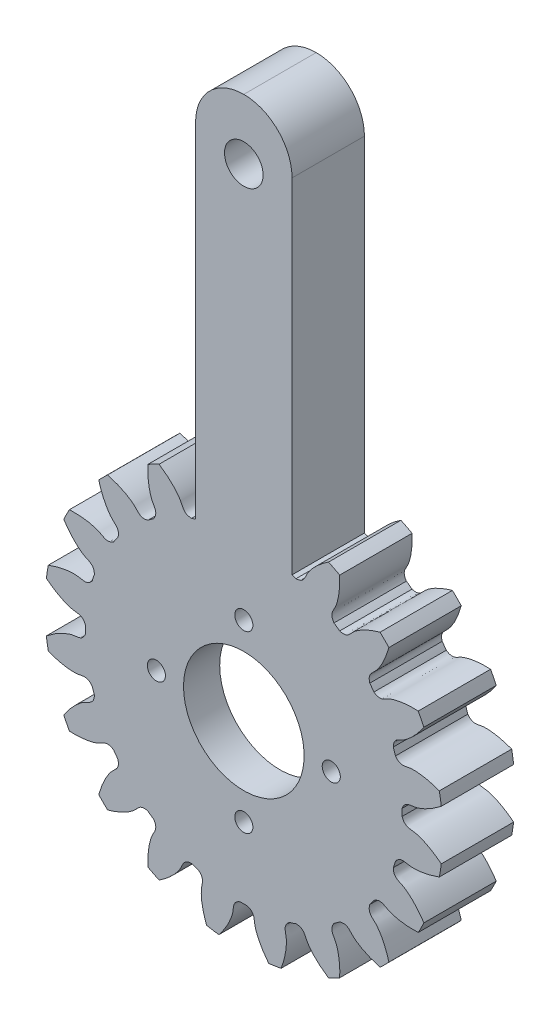
from build123d import *

# Parameters (mm, degrees)
SKETCH_1_R               = 16.5
EXTRUDE_1_DEPTH          = 6
CUT_EXTRUDE_1_DEPTH      = 25.093567606
PATTERN_CIRCULAR_1_COUNT = 20
SKETCH_5_R               = 10.75
CUT_EXTRUDE_2_DEPTH      = 3
SKETCH_6_R               = 5
CUT_EXTRUDE_3_DEPTH      = 3
SKETCH_7_R               = 0.75
CUT_EXTRUDE_4_DEPTH      = 3
SKETCH_8_W               = 8
SKETCH_8_H               = 38.434899951
EXTRUDE_2_DEPTH          = 6
SKETCH_9_R               = 1.6
SKETCH_9_W               = 8
SKETCH_9_H               = 5
CUT_EXTRUDE_5_DEPTH      = 10
FILLET_1_R               = 4


with BuildPart() as part:
    # 草图1 → 凸台-拉伸1 (new body)
    with BuildSketch(Plane.XY):
        Circle(SKETCH_1_R)
    extrude(amount=EXTRUDE_1_DEPTH)

    # 草图2 → 切除-拉伸1 (cut, through all)
    with BuildSketch(Plane.XY):
        with BuildLine():
            ThreePointArc((0.289974901, 13.121796354), (0, 13.125), (-0.289974901, 13.121796354))
            add(Edge.make_bspline(
                [(-0.289974901, 13.121796354), (-0.916784107, 13.340213268), (-0.835626149, 13.780670548), (-0.919345585, 14.205014104), (-0.928338279, 14.246334921), (-0.939466335, 14.292951923), (-0.952938145, 14.344795254), (-0.96896871, 14.401787245), (-0.987768083, 14.463844242), (-1.009544807, 14.5308761), (-1.034504625, 14.602786421), (-1.06285065, 14.679472568), (-1.094783098, 14.760825751), (-1.130499153, 14.846731096), (-1.170192797, 14.937067727), (-1.214054647, 15.031708847), (-1.2622718, 15.130521826), (-1.315027675, 15.233368292), (-1.372501858, 15.340104225), (-1.434869948, 15.450580056), (-1.502303414, 15.564640771), (-1.574969439, 15.682126017), (-1.653030782, 15.802870208), (-1.736645634, 15.926702646), (-1.825967477, 16.05344763), (-1.921144951, 16.182924586), (-2.022321721, 16.314948181), (-2.129636342, 16.449328459), (-2.24322214, 16.585870967), (-2.363207078, 16.724376892), (-2.489713645, 16.864643194), (-2.622858733, 17.006462752), (-2.762753527, 17.149624504), (-2.909503389, 17.29391359), (-3.06320776, 17.439111509), (-3.223960048, 17.584996263), (-3.391847534, 17.731342516), (-3.566951278, 17.877921749), (-3.749346018, 18.024502419), (-3.939100102, 18.170850122), (-4.136275349, 18.31672776), (-4.412210386, 18.512459802), (-4.625898619, 18.654498902), (-4.771736973, 18.747377789)],
                knots=[0, 0, 0, 0, 0.165916003, 0.170905922, 0.176663519, 0.183188797, 0.190481754, 0.198542391, 0.207370708, 0.216966704, 0.22733038, 0.238461736, 0.250360771, 0.263027487, 0.276461881, 0.290663956, 0.30563371, 0.321371144, 0.337876258, 0.355149051, 0.373189524, 0.391997677, 0.411573509, 0.431917021, 0.453028213, 0.474907084, 0.497553636, 0.520967867, 0.545149777, 0.570099367, 0.595816637, 0.622301587, 0.649554216, 0.677574526, 0.706362514, 0.735918183, 0.766241531, 0.797332559, 0.829191267, 0.861817654, 0.895211721, 0.929373468, 1, 1, 1, 1], degree=3))
            ThreePointArc((-4.771736973, 18.747377789), (0, 19.345119481), (4.771736973, 18.747377789))
            add(Edge.make_bspline(
                [(0.289974901, 13.121796354), (0.916784107, 13.340213268), (0.835626149, 13.780670548), (0.919345585, 14.205014104), (0.928338279, 14.246334921), (0.939466335, 14.292951923), (0.952938145, 14.344795254), (0.96896871, 14.401787245), (0.987768083, 14.463844242), (1.009544807, 14.5308761), (1.034504625, 14.602786421), (1.06285065, 14.679472568), (1.094783098, 14.760825751), (1.130499153, 14.846731096), (1.170192797, 14.937067727), (1.214054647, 15.031708847), (1.2622718, 15.130521826), (1.315027675, 15.233368292), (1.372501858, 15.340104225), (1.434869948, 15.450580056), (1.502303414, 15.564640771), (1.574969439, 15.682126017), (1.653030782, 15.802870208), (1.736645634, 15.926702646), (1.825967477, 16.05344763), (1.921144951, 16.182924586), (2.022321721, 16.314948181), (2.129636342, 16.449328459), (2.24322214, 16.585870967), (2.363207078, 16.724376892), (2.489713645, 16.864643194), (2.622858733, 17.006462752), (2.762753527, 17.149624504), (2.909503389, 17.29391359), (3.06320776, 17.439111509), (3.223960048, 17.584996263), (3.391847534, 17.731342516), (3.566951278, 17.877921749), (3.749346018, 18.024502419), (3.939100102, 18.170850122), (4.136275349, 18.31672776), (4.412210386, 18.512459802), (4.625898619, 18.654498902), (4.771736973, 18.747377789)],
                knots=[0, 0, 0, 0, 0.165916003, 0.170905922, 0.176663519, 0.183188797, 0.190481754, 0.198542391, 0.207370708, 0.216966704, 0.22733038, 0.238461736, 0.250360771, 0.263027487, 0.276461881, 0.290663956, 0.30563371, 0.321371144, 0.337876258, 0.355149051, 0.373189524, 0.391997677, 0.411573509, 0.431917021, 0.453028213, 0.474907084, 0.497553636, 0.520967867, 0.545149777, 0.570099367, 0.595816637, 0.622301587, 0.649554216, 0.677574526, 0.706362514, 0.735918183, 0.766241531, 0.797332559, 0.829191267, 0.861817654, 0.895211721, 0.929373468, 1, 1, 1, 1], degree=3))
        make_face()
    cut_extrude_1 = extrude(amount=CUT_EXTRUDE_1_DEPTH, mode=Mode.SUBTRACT)

    # 阵列(圆周)1: 切除-拉伸1 ×20 about axis
    pattern_circular_1_axis = Axis((0, 0, -0.3), (0, 0, 1))
    for i in range(1, PATTERN_CIRCULAR_1_COUNT):
        add(cut_extrude_1.rotate(pattern_circular_1_axis, i * 360 / PATTERN_CIRCULAR_1_COUNT), mode=Mode.SUBTRACT)

    # 草图5 → 切除-拉伸2 (cut)
    with BuildSketch(Plane(origin=(0, 0, 0), x_dir=(-1, 0, 0), z_dir=(0, 0, -1))):
        Circle(SKETCH_5_R)
    extrude(amount=-CUT_EXTRUDE_2_DEPTH, mode=Mode.SUBTRACT)

    # 草图6 → 切除-拉伸3 (cut)
    with BuildSketch(Plane(origin=(0, 0, 3), x_dir=(-1, 0, 0), z_dir=(0, 0, -1))):
        Circle(SKETCH_6_R)
    extrude(amount=-CUT_EXTRUDE_3_DEPTH, mode=Mode.SUBTRACT)

    # 草图7 → 切除-拉伸4 (cut)
    with BuildSketch(Plane(origin=(0, 0, 3), x_dir=(-1, 0, 0), z_dir=(0, 0, -1))):
        with Locations((0, 7.25)):
            Circle(SKETCH_7_R)
        with Locations((7.25, 0)):
            Circle(SKETCH_7_R)
        with Locations(Location((0, -7.25, 0), (0, 0, 180))):
            Circle(SKETCH_7_R)
        with Locations(Location((-7.25, 0, 0), (0, 0, 180))):
            Circle(SKETCH_7_R)
    extrude(amount=-CUT_EXTRUDE_4_DEPTH, mode=Mode.SUBTRACT)

    # 草图8 → 凸台-拉伸2 (add)
    with BuildSketch(Plane(origin=(0, 0, 0), x_dir=(-1, 0, 0), z_dir=(0, 0, -1))):
        with Locations((0, 30.782550025)):
            Rectangle(SKETCH_8_W, SKETCH_8_H)
    extrude(amount=-EXTRUDE_2_DEPTH)

    # 草图9 → 切除-拉伸5 (cut)
    with BuildSketch(Plane(origin=(0, 0, 0), x_dir=(-1, 0, 0), z_dir=(0, 0, -1))):
        with Locations((0, 40)):
            Circle(SKETCH_9_R)
        with Locations((0, 47.5)):
            Rectangle(SKETCH_9_W, SKETCH_9_H)
    extrude(amount=-CUT_EXTRUDE_5_DEPTH, mode=Mode.SUBTRACT)

    # 圆角1
    fillet_1_edges = [part.edges().sort_by_distance(p)[0] for p in [
        (4, 45, 3),
        (-4, 45, 3),
    ]]
    fillet(fillet_1_edges, radius=FILLET_1_R - 0.0001)  # a hair under: the kernel refuses the full size


solid = part.part
